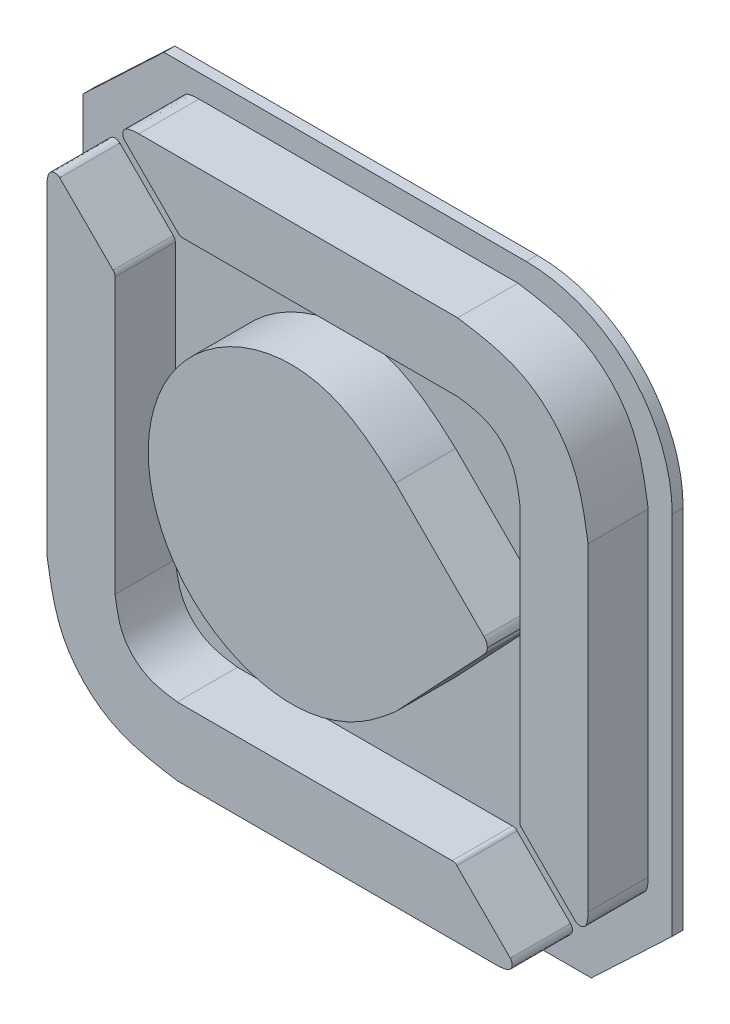
from build123d import *

# Parameters (mm, degrees)
BOSS_EXTRUDE1_DEPTH   = 3.9
BOSS_EXTRUDE1_2_DEPTH = 3.9
BOSS_EXTRUDE1_3_DEPTH = 3.9
BOSS_EXTRUDE2_DEPTH   = 0.6


with BuildPart() as part:
    # Sketch1 → Boss-Extrude1 (new body)
    with BuildSketch(Plane.XY):
        with BuildLine():
            Line((25.229066542, 14.042398915), (20.375912248, 18.895835208))
            add(Edge.make_bspline(
                [(20.375912248, 18.895835208), (20.37174169, 18.90030155), (20.363576223, 18.909046127), (20.351110364, 18.92144846), (19.844787844, 19.379927063), (18.799440475, 20.273363179), (16.995059842, 21.373538365), (14.172109181, 21.93132016), (10.636849764, 20.889054622), (7.574833239, 17.821449288), (6.431389178, 13.601500632), (7.572554288, 9.384558531), (10.640870115, 6.329524692), (14.161359343, 5.320888169), (16.956398806, 5.831466925), (18.830032615, 6.745357676), (19.872482313, 7.619008821), (20.375912248, 8.040920918)],
                knots=[0, 0, 0, 0, 0.000489092, 0.000957584, 0.001406885, 0.055155152, 0.111026991, 0.168427122, 0.280644353, 0.389809521, 0.502189722, 0.614354085, 0.723170681, 0.835316449, 0.891384032, 0.947546121, 1, 1, 1, 1], degree=3))
            Line((20.375912248, 8.040920918), (25.229066542, 13.190760618))
            add(Edge.make_bspline(
                [(25.229066542, 13.190760618), (25.262942343, 13.229895763), (25.329894966, 13.307243031), (25.399159621, 13.446971053), (25.408981304, 13.548047675), (25.413887172, 13.598534803)],
                knots=[0, 0, 0, 0, 0.338885039, 0.6697773, 1, 1, 1, 1], degree=3))
            add(Edge.make_bspline(
                [(25.413887172, 13.598534803), (25.408800814, 13.651168442), (25.398325892, 13.75956295), (25.334527414, 13.913795366), (25.264035787, 13.999755905), (25.229066542, 14.042398915)],
                knots=[0, 0, 0, 0, 0.322338023, 0.663827768, 1, 1, 1, 1], degree=3))
        make_face()
    extrude(amount=BOSS_EXTRUDE1_DEPTH)



with BuildPart() as body_2:
    # Sketch1 → Boss-Extrude1 2 (new body)
    with BuildSketch(Plane.XY):
        with BuildLine():
            Line((27.195798608, 21.304633391), (27.195798608, 6.225916548))
            add(Edge.make_bspline(
                [(27.195798608, 6.225916548), (27.197473585, 6.203780737), (27.200757175, 6.160386132), (27.208437152, 6.09521782), (27.234446999, 6.046031359), (27.259902965, 6.010051451), (27.283293373, 5.986748683), (27.298409936, 5.972448647), (27.305794388, 5.965463069)],
                knots=[0, 0, 0, 0, 0.227492727, 0.445972237, 0.663373124, 0.787115425, 0.896005733, 1, 1, 1, 1], degree=3))
            Line((27.305794388, 5.965463069), (30.232858534, 3.038505923))
            add(Edge.make_bspline(
                [(30.232858534, 3.038505923), (30.272147183, 3.009535404), (30.350815183, 2.951527484), (30.49900716, 2.92750814), (30.634931808, 2.954746851), (30.744436205, 3.022056044), (30.823338473, 3.112516555), (30.872722532, 3.245491946), (30.905013233, 3.405627201), (30.938324426, 3.590734083), (30.935770522, 3.721080707), (30.937288745, 3.792396713), (30.937913108, 3.804764227), (30.937328822, 3.812997119), (30.937036126, 3.817121366)],
                knots=[0, 0, 0, 0, 0.104345134, 0.208931166, 0.313565445, 0.39799532, 0.482811187, 0.567894079, 0.701186565, 0.836715425, 0.973246641, 0.982162759, 0.991064478, 1, 1, 1, 1], degree=3))
            Line((30.937036126, 3.817121366), (30.937036126, 21.304633391))
            add(Edge.make_bspline(
                [(30.937036126, 21.304633391), (30.737506729, 22.553511837), (30.34351464, 25.019555615), (27.503029888, 27.86010153), (25.03668302, 28.254077851), (23.787514425, 28.453621093)],
                knots=[0, 0, 0, 0, 0.336153842, 0.663771636, 1, 1, 1, 1], degree=3))
            Line((23.787514425, 28.453621093), (6.300389399, 28.452210095))
            add(Edge.make_bspline(
                [(6.300389399, 28.452210095), (6.29640785, 28.452504177), (6.288543003, 28.453085085), (6.276681481, 28.452460162), (6.205476507, 28.45089347), (6.074892661, 28.453932033), (5.889398335, 28.420142975), (5.72852884, 28.390350296), (5.596463219, 28.338840888), (5.506178185, 28.260183449), (5.438172438, 28.150996561), (5.410912193, 28.014755531), (5.435247252, 27.86622645), (5.493961341, 27.787439712), (5.523327953, 27.748033504)],
                knots=[0, 0, 0, 0, 0.008621864, 0.017030969, 0.025643238, 0.162638148, 0.298245388, 0.431901383, 0.516391776, 0.601007159, 0.685956809, 0.790142009, 0.895036806, 1, 1, 1, 1], degree=3))
            Line((5.523327953, 27.748033504), (8.450249099, 24.822456355))
            add(Edge.make_bspline(
                [(8.450249099, 24.822456355), (8.459512379, 24.81351164), (8.477690302, 24.795958857), (8.504698717, 24.768761339), (8.540249137, 24.740073025), (8.58934255, 24.720141118), (8.64860069, 24.710556551), (8.688456113, 24.71083417), (8.709187582, 24.710978578)],
                knots=[0, 0, 0, 0, 0.131285455, 0.257629811, 0.390972346, 0.594165008, 0.788898108, 1, 1, 1, 1], degree=3))
            Line((8.709187582, 24.710978578), (23.787514425, 24.712389575))
            add(Edge.make_bspline(
                [(23.787514425, 24.712389575), (24.391448766, 24.62415884), (25.571785515, 24.451719601), (26.934840305, 23.08973287), (27.107453588, 21.90896231), (27.195798608, 21.304633391)],
                knots=[0, 0, 0, 0, 0.338409749, 0.6613922, 1, 1, 1, 1], degree=3))
        make_face()
    extrude(amount=BOSS_EXTRUDE1_2_DEPTH)


with BuildPart() as body_3:
    # Sketch1 → Boss-Extrude1 3 (new body)
    with BuildSketch(Plane.XY):
        with BuildLine():
            Line((5.000757998, 5.928526143), (5.000757998, 21.006852986))
            add(Edge.make_bspline(
                [(5.000757998, 21.006852986), (5.000026801, 21.025975739), (4.998682897, 21.06112239), (4.990248279, 21.115085868), (4.969902459, 21.159385589), (4.946157897, 21.19936859), (4.92014154, 21.233850519), (4.899867362, 21.255831195), (4.889280221, 21.267309465)],
                knots=[0, 0, 0, 0, 0.196745559, 0.361608386, 0.557261599, 0.692766378, 0.839563136, 1, 1, 1, 1], degree=3))
            Line((4.889280221, 21.267309465), (1.962334075, 24.194264611))
            add(Edge.make_bspline(
                [(1.962334075, 24.194264611), (1.923025866, 24.223235907), (1.844341394, 24.281228655), (1.696175972, 24.305251672), (1.560189631, 24.278073419), (1.450756878, 24.210445961), (1.37209657, 24.120038069), (1.322144111, 23.987549912), (1.289592927, 23.827445004), (1.25932234, 23.64239208), (1.253820988, 23.511841913), (1.259038824, 23.440505478), (1.258405649, 23.428044589), (1.258238143, 23.419779203), (1.258154484, 23.415651169)],
                knots=[0, 0, 0, 0, 0.104384754, 0.208950226, 0.313569176, 0.398093487, 0.483012464, 0.567612364, 0.700915154, 0.836484685, 0.973043492, 0.982112009, 0.991066088, 1, 1, 1, 1], degree=3))
            Line((1.258154484, 23.415651169), (1.258154484, 5.928526143))
            add(Edge.make_bspline(
                [(1.258154484, 5.928526143), (1.457806932, 4.679515466), (1.852059068, 2.213103792), (4.692865099, -0.627981345), (7.159639924, -1.021541552), (8.408903182, -1.220854558)],
                knots=[0, 0, 0, 0, 0.336156644, 0.663805911, 1, 1, 1, 1], degree=3))
            Line((8.408903182, -1.220854558), (25.894686211, -1.219443561))
            add(Edge.make_bspline(
                [(25.894686211, -1.219443561), (25.898820459, -1.219735738), (25.907107301, -1.220321388), (25.919603859, -1.21969367), (25.991036631, -1.218209581), (26.121456714, -1.220751355), (26.306503702, -1.187373665), (26.466574461, -1.155540512), (26.599075296, -1.105533977), (26.689491678, -1.02694469), (26.757089978, -0.917508365), (26.784285006, -0.7814837), (26.7599399, -0.633015851), (26.701254088, -0.554532231), (26.671890656, -0.515262969)],
                knots=[0, 0, 0, 0, 0.008953482, 0.017946692, 0.027021307, 0.163490993, 0.298949058, 0.432165007, 0.516776033, 0.601601228, 0.686034701, 0.790672378, 0.895262972, 1, 1, 1, 1], degree=3))
            Line((26.671890656, -0.515262969), (23.74493251, 2.411657177))
            add(Edge.make_bspline(
                [(23.74493251, 2.411657177), (23.735734109, 2.421246601), (23.717626748, 2.440123703), (23.689823503, 2.468688547), (23.656581443, 2.499135954), (23.607130585, 2.515934332), (23.548567114, 2.520555312), (23.507716462, 2.521342426), (23.485995028, 2.521760956)],
                knots=[0, 0, 0, 0, 0.134581529, 0.264928249, 0.404990742, 0.58604785, 0.779890073, 1, 1, 1, 1], degree=3))
            Line((23.485995028, 2.521760956), (8.408903182, 2.520631959))
            add(Edge.make_bspline(
                [(8.408903182, 2.520631959), (7.804811559, 2.60856512), (6.624190433, 2.780419427), (5.261495662, 4.143251365), (5.089031476, 5.324116288), (5.000757998, 5.928526143)],
                knots=[0, 0, 0, 0, 0.33840601, 0.661371999, 1, 1, 1, 1], degree=3))
        make_face()
    extrude(amount=BOSS_EXTRUDE1_3_DEPTH)


with BuildPart() as part_1:
    add(part.part)

    add(body_2.part)  # Boss-Extrude2 merges body 2

    add(body_3.part)  # Boss-Extrude2 merges body 3
    # Sketch2 → Boss-Extrude2 (add)
    with BuildSketch(Plane.XY):
        with BuildLine():
            Line((4.380020281, 29.710868429), (-0.055833162, 25.517811662))
            Line((-0.055833162, 25.517811662), (-0.055833162, 5.465863294))
            ThreePointArc((-0.055833162, 5.465863294), (2.287312588, -0.190990955), (7.944166838, -2.534136706))
            Line((7.944166838, -2.534136706), (27.815170328, -2.534136706))
            Line((27.815170328, -2.534136706), (32.251023772, 1.658920061))
            Line((32.251023772, 1.658920061), (32.251023772, 21.710868429))
            ThreePointArc((32.251023772, 21.710868429), (29.907878021, 27.367722678), (24.251023772, 29.710868429))
            Line((24.251023772, 29.710868429), (4.380020281, 29.710868429))
        make_face()
    extrude(amount=BOSS_EXTRUDE2_DEPTH)


solid = part_1.part
